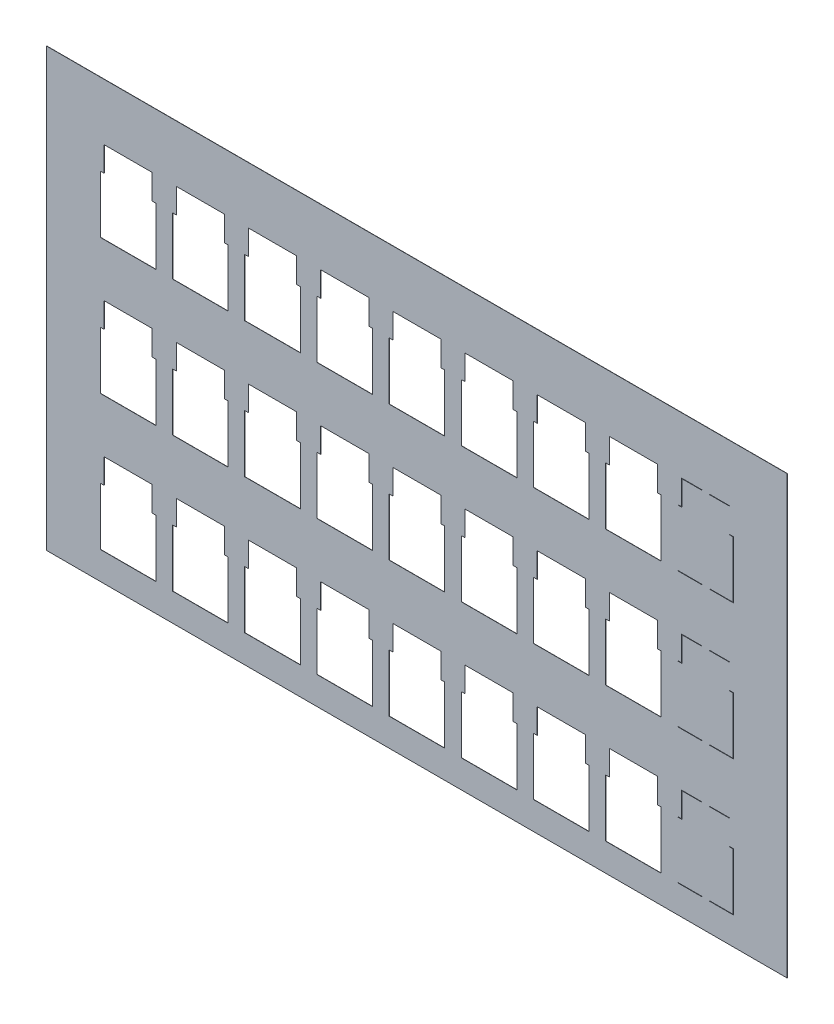
from build123d import *

# Parameters (mm, degrees)
MODEL_W            = 1870
MODEL_H            = 1180
BASE_FLANGE1_DEPTH = 0.6
TAB1_DEPTH         = 0.6
SKETCH7_W          = 65
SKETCH7_H          = 1180
TAB2_DEPTH         = 0.6


# Sheet-metal steps are written as plain solids
with BuildPart() as part:
    # Model → Base-Flange1 (new body)
    with BuildSketch(Plane.XY):
        with Locations((935, 590)):
            Rectangle(MODEL_W, MODEL_H)
        Polygon((1790, 440), (1640, 440), (1640, 595), (1650, 595), (1650, 662), (1780, 662), (1780, 595), (1790, 595), align=None, mode=Mode.SUBTRACT)
        Polygon((1595, 440), (1445, 440), (1445, 595), (1455, 595), (1455, 662), (1585, 662), (1585, 595), (1595, 595), align=None, mode=Mode.SUBTRACT)
        Polygon((1400, 440), (1250, 440), (1250, 595), (1260, 595), (1260, 662), (1390, 662), (1390, 595), (1400, 595), align=None, mode=Mode.SUBTRACT)
        Polygon((1205, 440), (1055, 440), (1055, 595), (1065, 595), (1065, 662), (1195, 662), (1195, 595), (1205, 595), align=None, mode=Mode.SUBTRACT)
        Polygon((1010, 440), (860, 440), (860, 595), (870, 595), (870, 662), (1000, 662), (1000, 595), (1010, 595), align=None, mode=Mode.SUBTRACT)
        Polygon((815, 440), (665, 440), (665, 595), (675, 595), (675, 662), (805, 662), (805, 595), (815, 595), align=None, mode=Mode.SUBTRACT)
        Polygon((620, 440), (470, 440), (470, 595), (480, 595), (480, 662), (610, 662), (610, 595), (620, 595), align=None, mode=Mode.SUBTRACT)
        Polygon((425, 440), (275, 440), (275, 595), (285, 595), (285, 662), (415, 662), (415, 595), (425, 595), align=None, mode=Mode.SUBTRACT)
        Polygon((230, 440), (80, 440), (80, 595), (90, 595), (90, 662), (220, 662), (220, 595), (230, 595), align=None, mode=Mode.SUBTRACT)
        Polygon((1790, 805), (1640, 805), (1640, 960), (1650, 960), (1650, 1027), (1780, 1027), (1780, 960), (1790, 960), align=None, mode=Mode.SUBTRACT)
        Polygon((1595, 805), (1445, 805), (1445, 960), (1455, 960), (1455, 1027), (1585, 1027), (1585, 960), (1595, 960), align=None, mode=Mode.SUBTRACT)
        Polygon((1400, 805), (1250, 805), (1250, 960), (1260, 960), (1260, 1027), (1390, 1027), (1390, 960), (1400, 960), align=None, mode=Mode.SUBTRACT)
        Polygon((1205, 805), (1055, 805), (1055, 960), (1065, 960), (1065, 1027), (1195, 1027), (1195, 960), (1205, 960), align=None, mode=Mode.SUBTRACT)
        Polygon((1010, 805), (860, 805), (860, 960), (870, 960), (870, 1027), (1000, 1027), (1000, 960), (1010, 960), align=None, mode=Mode.SUBTRACT)
        Polygon((815, 805), (665, 805), (665, 960), (675, 960), (675, 1027), (805, 1027), (805, 960), (815, 960), align=None, mode=Mode.SUBTRACT)
        Polygon((620, 805), (470, 805), (470, 960), (480, 960), (480, 1027), (610, 1027), (610, 960), (620, 960), align=None, mode=Mode.SUBTRACT)
        Polygon((425, 805), (275, 805), (275, 960), (285, 960), (285, 1027), (415, 1027), (415, 960), (425, 960), align=None, mode=Mode.SUBTRACT)
        Polygon((230, 805), (80, 805), (80, 960), (90, 960), (90, 1027), (220, 1027), (220, 960), (230, 960), align=None, mode=Mode.SUBTRACT)
        Polygon((1790, 75), (1640, 75), (1640, 230), (1650, 230), (1650, 297), (1780, 297), (1780, 230), (1790, 230), align=None, mode=Mode.SUBTRACT)
        Polygon((1595, 75), (1445, 75), (1445, 230), (1455, 230), (1455, 297), (1585, 297), (1585, 230), (1595, 230), align=None, mode=Mode.SUBTRACT)
        Polygon((1400, 75), (1250, 75), (1250, 230), (1260, 230), (1260, 297), (1390, 297), (1390, 230), (1400, 230), align=None, mode=Mode.SUBTRACT)
        Polygon((1205, 75), (1055, 75), (1055, 230), (1065, 230), (1065, 297), (1195, 297), (1195, 230), (1205, 230), align=None, mode=Mode.SUBTRACT)
        Polygon((1010, 75), (860, 75), (860, 230), (870, 230), (870, 297), (1000, 297), (1000, 230), (1010, 230), align=None, mode=Mode.SUBTRACT)
        Polygon((815, 75), (665, 75), (665, 230), (675, 230), (675, 297), (805, 297), (805, 230), (815, 230), align=None, mode=Mode.SUBTRACT)
        Polygon((620, 75), (470, 75), (470, 230), (480, 230), (480, 297), (610, 297), (610, 230), (620, 230), align=None, mode=Mode.SUBTRACT)
        Polygon((425, 75), (275, 75), (275, 230), (285, 230), (285, 297), (415, 297), (415, 230), (425, 230), align=None, mode=Mode.SUBTRACT)
        Polygon((230, 75), (80, 75), (80, 230), (90, 230), (90, 297), (220, 297), (220, 230), (230, 230), align=None, mode=Mode.SUBTRACT)
    extrude(amount=-BASE_FLANGE1_DEPTH)

    # Sketch6 → Tab1 (add)
    with BuildSketch(Plane.XY):
        Polygon((1705, 805), (1725, 805), (1725, 806), (1789, 806), (1789, 959), (1779, 959), (1779, 1026), (1725, 1026), (1725, 1027), (1705, 1027), (1705, 1026), (1651, 1026), (1651, 959), (1641, 959), (1641, 806), (1705, 806), align=None)
        Polygon((1705, 440), (1725, 440), (1725, 441), (1789, 441), (1789, 594), (1779, 594), (1779, 661), (1725, 661), (1725, 662), (1705, 662), (1705, 661), (1651, 661), (1651, 594), (1641, 594), (1641, 441), (1705, 441), align=None)
        Polygon((1705, 75), (1725, 75), (1725, 76), (1789, 76), (1789, 229), (1779, 229), (1779, 296), (1725, 296), (1725, 297), (1705, 297), (1705, 296), (1651, 296), (1651, 229), (1641, 229), (1641, 76), (1705, 76), align=None)
    extrude(amount=-TAB1_DEPTH)

    # Sketch7 → Tab2 (add)
    with BuildSketch(Plane.XY):
        with Locations((1902.5, 590)):
            Rectangle(SKETCH7_W, SKETCH7_H)
        with Locations((-32.5, 590)):
            Rectangle(SKETCH7_W, SKETCH7_H)
    extrude(amount=-TAB2_DEPTH)


solid = part.part
